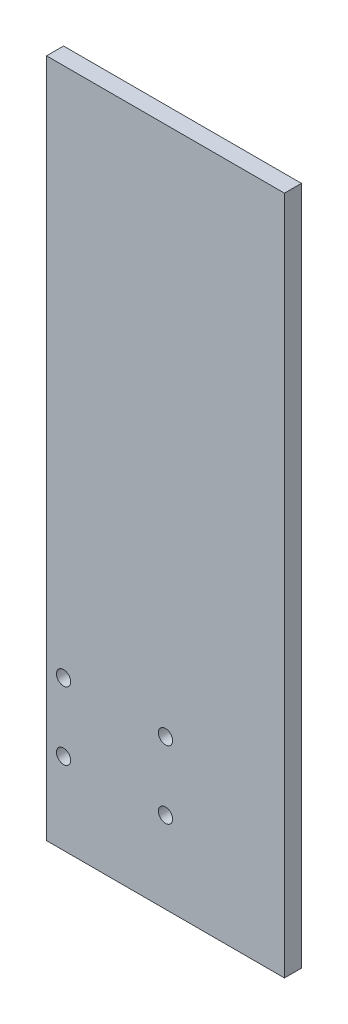
from build123d import *

# Parameters (mm, degrees)
SKETCH_1_W          = 100
SKETCH_1_H          = 200
EXTRUDE_1_DEPTH     = 5
CUT_EXTRUDE_2_DEPTH = 0.001
M4X0_7_HELICOIL_1_D = 4.2
SKETCH_13_W         = 10
SKETCH_13_H         = 200
CUT_EXTRUDE_4_DEPTH = 10
SKETCH_14_W         = 10
SKETCH_14_H         = 200
CUT_EXTRUDE_5_DEPTH = 10


with BuildPart() as part:
    # 스케치1 → 보스-돌출1 (new body)
    with BuildSketch(Plane.XY):
        Rectangle(SKETCH_1_W, SKETCH_1_H)
    extrude(amount=EXTRUDE_1_DEPTH)

    # 스케치3 → 컷-돌출2 (cut)
    # profile 1 of 5: a face of its own
    with BuildSketch(Plane(origin=(0, 0, 0), x_dir=(-1, 0, 0), z_dir=(0, 0, -1))):
        with BuildLine():
            Line((1.435897436, 3.568709936), (1.435897436, 3.241987179))
            add(Edge.make_bspline(
                [(1.435897436, 3.241987179), (1.406158657, 3.253938052), (1.349713836, 3.276621056), (1.26647346, 3.301285681), (1.189944626, 3.317221421), (1.140790736, 3.319457366), (1.117588141, 3.320512821)],
                knots=[0, 0, 0, 0, 1.16548392, 2.212112691, 3.15604595, 4, 4, 4, 4], degree=3))
            add(Edge.make_bspline(
                [(1.117588141, 3.320512821), (1.101914377, 3.31986148), (1.071575198, 3.318600703), (1.027971871, 3.312172427), (0.988682661, 3.299069626), (0.953777041, 3.28204035), (0.924826581, 3.260686166), (0.900040357, 3.239230902), (0.882073827, 3.215045722), (0.872318879, 3.192525311), (0.866368878, 3.171674318), (0.86457875, 3.150320052), (0.860193836, 3.124095966), (0.858971029, 3.091932248), (0.856183661, 3.054829537), (0.856430302, 3.012002641), (0.854146379, 2.964125498), (0.854488293, 2.930224949), (0.854667468, 2.912459936)],
                knots=[0, 0, 0, 0, 1.311993654, 2.539582093, 3.670788641, 4.763509788, 5.772417512, 6.671800701, 7.496729179, 8.266799162, 8.712543678, 9.304149002, 10.05334463, 10.934920737, 11.99209668, 13.165090968, 14.514413552, 16, 16, 16, 16], degree=3))
            Line((0.854667468, 2.912459936), (0.854667468, 2.557692308))
            Line((0.854667468, 2.557692308), (1.391025641, 2.557692308))
            Line((1.391025641, 2.557692308), (1.391025641, 2.243589744))
            Line((1.391025641, 2.243589744), (0.853966346, 2.243589744))
            Line((0.853966346, 2.243589744), (0.852564103, 0))
            Line((0.852564103, 0), (0.538461538, 0))
            Line((0.538461538, 0), (0.538461538, 2.243589744))
            Line((0.538461538, 2.243589744), (0.179487179, 2.243589744))
            Line((0.179487179, 2.243589744), (0.179487179, 2.557692308))
            Line((0.179487179, 2.557692308), (0.538461538, 2.557692308))
            Line((0.538461538, 2.557692308), (0.538461538, 2.966446314))
            add(Edge.make_bspline(
                [(0.538461538, 2.966446314), (0.538486753, 2.989121894), (0.538535124, 3.032622798), (0.541922975, 3.095232239), (0.544818696, 3.153055703), (0.550586323, 3.205644336), (0.557248029, 3.253490479), (0.566784189, 3.29588336), (0.57579556, 3.333965119), (0.592144152, 3.377067776), (0.616566371, 3.4259178), (0.656096568, 3.4775417), (0.703489575, 3.523846647), (0.760097899, 3.562854), (0.823813434, 3.595269478), (0.894694612, 3.618511331), (0.97196981, 3.631651776), (1.02545728, 3.633605985), (1.053084936, 3.634615385)],
                knots=[0, 0, 0, 0, 1.116398763, 2.141702935, 3.087165306, 3.966655413, 4.746276475, 5.464069668, 6.106083417, 6.67047701, 7.730773247, 8.782666744, 9.856985883, 10.980834087, 12.154321827, 13.366232824, 14.639591414, 16, 16, 16, 16], degree=3))
            add(Edge.make_bspline(
                [(1.053084936, 3.634615385), (1.081161694, 3.633658004), (1.140107358, 3.631648034), (1.232303961, 3.619214627), (1.331900478, 3.597743597), (1.400236399, 3.578665712), (1.435897436, 3.568709936)],
                knots=[0, 0, 0, 0, 0.864728408, 1.815451418, 2.859995356, 4, 4, 4, 4], degree=3))
        make_face()
    # profile 2 of 5: a face of its own
    with BuildSketch(Plane(origin=(0, 0, 0), x_dir=(-1, 0, 0), z_dir=(0, 0, -1))):
        with BuildLine():
            Line((1.794871795, 2.557692308), (2.108974359, 2.557692308))
            Line((2.108974359, 2.557692308), (2.108974359, 2.181189904))
            add(Edge.make_bspline(
                [(2.108974359, 2.181189904), (2.132163118, 2.216245732), (2.176511439, 2.283289731), (2.250224368, 2.371959032), (2.325727699, 2.445374079), (2.403382887, 2.503877598), (2.483760987, 2.547690717), (2.565097938, 2.579783752), (2.648673408, 2.598761067), (2.704835332, 2.601294726), (2.732972756, 2.602564103)],
                knots=[0, 0, 0, 0, 1.2804753, 2.448899062, 3.506932113, 4.484331642, 5.4025378, 6.288909075, 7.142734305, 8, 8, 8, 8], degree=3))
            add(Edge.make_bspline(
                [(2.732972756, 2.602564103), (2.754799083, 2.601373576), (2.799708168, 2.59892399), (2.867690758, 2.581713165), (2.93773421, 2.554235143), (2.982876597, 2.52839492), (3.006410256, 2.514923878)],
                knots=[0, 0, 0, 0, 0.901110191, 1.854092781, 2.881294221, 4, 4, 4, 4], degree=3))
            Line((3.006410256, 2.514923878), (2.833934295, 2.242888622))
            add(Edge.make_bspline(
                [(2.833934295, 2.242888622), (2.818825274, 2.249628888), (2.790145459, 2.262423203), (2.748190893, 2.277565213), (2.709509556, 2.286481129), (2.684865998, 2.287831847), (2.673377404, 2.288461538)],
                knots=[0, 0, 0, 0, 1.180555205, 2.24091978, 3.179933427, 4, 4, 4, 4], degree=3))
            add(Edge.make_bspline(
                [(2.673377404, 2.288461538), (2.64817167, 2.286781501), (2.59675928, 2.283354712), (2.521274781, 2.256415904), (2.448027575, 2.212890664), (2.389855913, 2.164619552), (2.34481366, 2.118071755), (2.312673435, 2.077423352), (2.283190688, 2.031844721), (2.255020467, 1.982115037), (2.229354173, 1.927385191), (2.205399504, 1.868201977), (2.183740641, 1.804496849), (2.171390397, 1.760114328), (2.165064103, 1.737379808)],
                knots=[0, 0, 0, 0, 1.125678352, 2.296057538, 3.5422874, 4.923748041, 5.663163013, 6.437101912, 7.23742474, 8.08941207, 8.991984279, 9.93940061, 10.944477711, 12, 12, 12, 12], degree=3))
            add(Edge.make_bspline(
                [(2.165064103, 1.737379808), (2.160331709, 1.717102634), (2.149849818, 1.672190235), (2.13965828, 1.596841711), (2.129588762, 1.507818052), (2.122492143, 1.404871459), (2.115914101, 1.288259015), (2.112204019, 1.15780307), (2.109100878, 1.013369718), (2.109017812, 0.912395365), (2.108974359, 0.859575321)],
                knots=[0, 0, 0, 0, 0.566838948, 1.255505196, 2.06880316, 3.007127437, 4.065329342, 5.249902469, 6.561414163, 8, 8, 8, 8], degree=3))
            Line((2.108974359, 0.859575321), (2.108974359, 0))
            Line((2.108974359, 0), (1.794871795, 0))
            Line((1.794871795, 0), (1.794871795, 2.557692308))
        make_face()
    # profile 3 of 5: a face of its own
    with BuildSketch(Plane(origin=(0, 0, 0), x_dir=(-1, 0, 0), z_dir=(0, 0, -1))):
        with BuildLine():
            add(Edge.make_bspline(
                [(4.555889423, 2.602564103), (4.603880696, 2.601542211), (4.697979853, 2.599538533), (4.835787739, 2.578123567), (4.967332875, 2.545376203), (5.093119067, 2.500104641), (5.211535363, 2.43942269), (5.324306607, 2.367013399), (5.431123616, 2.281230805), (5.495146645, 2.214872737), (5.527644231, 2.181189904)],
                knots=[0, 0, 0, 0, 1.054011418, 2.066658804, 3.057071809, 4.030435133, 4.997543892, 5.974964718, 6.972108034, 8, 8, 8, 8], degree=3))
            add(Edge.make_bspline(
                [(5.527644231, 2.181189904), (5.555626185, 2.148975918), (5.611048565, 2.085171376), (5.682114284, 1.981715763), (5.743335844, 1.874575662), (5.792398805, 1.762328336), (5.831083829, 1.645953664), (5.858549525, 1.525051653), (5.87488646, 1.399889306), (5.877089427, 1.314885468), (5.878205128, 1.271834936)],
                knots=[0, 0, 0, 0, 1.025258237, 2.030674902, 3.01204498, 3.988269485, 4.97094183, 5.956517959, 6.965070386, 8, 8, 8, 8], degree=3))
            add(Edge.make_bspline(
                [(5.878205128, 1.271834936), (5.877223791, 1.228534878), (5.875284623, 1.142971945), (5.856941006, 1.016952579), (5.82840992, 0.894757756), (5.787578082, 0.776899063), (5.735219973, 0.663016235), (5.671329285, 0.553606686), (5.595457668, 0.448454553), (5.509453671, 0.348452714), (5.414401795, 0.2562865), (5.311285647, 0.17595823), (5.202131613, 0.107136706), (5.08548826, 0.05170029), (4.962420773, 0.00799059), (4.832663705, -0.022709427), (4.696418635, -0.04127111), (4.603391413, -0.043654684), (4.555889423, -0.044871795)],
                knots=[0, 0, 0, 0, 0.998656419, 1.973391657, 2.932242238, 3.890759089, 4.846373663, 5.82037756, 6.809684879, 7.83454468, 8.860553229, 9.859544525, 10.845671541, 11.83227036, 12.833544569, 13.85385346, 14.904124723, 16, 16, 16, 16], degree=3))
            add(Edge.make_bspline(
                [(4.555889423, -0.044871795), (4.508154704, -0.043650599), (4.414663844, -0.041258824), (4.277937862, -0.022781541), (4.147948243, 0.007976441), (4.024719644, 0.051843934), (3.907574798, 0.107138478), (3.797788301, 0.175750167), (3.694588385, 0.256310322), (3.599516401, 0.348446259), (3.513517795, 0.448456216), (3.437644787, 0.553606254), (3.373754461, 0.663016348), (3.321396257, 0.776899033), (3.280564444, 0.894757764), (3.252033351, 1.016952577), (3.233689737, 1.142971945), (3.231750568, 1.228534878), (3.230769231, 1.271834936)],
                knots=[0, 0, 0, 0, 1.099876186, 2.154163076, 3.173186993, 4.173200201, 5.163417411, 6.152872554, 7.150605724, 8.17532212, 9.198891216, 10.186952605, 11.159729845, 12.11414092, 13.071450619, 14.029093627, 15.002601286, 16, 16, 16, 16], degree=3))
            add(Edge.make_bspline(
                [(3.230769231, 1.271834936), (3.231892541, 1.314651482), (3.234116503, 1.399420884), (3.250437012, 1.524347945), (3.277795568, 1.645045334), (3.316526965, 1.76097081), (3.366042155, 1.872726246), (3.426403443, 1.980131077), (3.498194076, 2.083118877), (3.553396027, 2.146840957), (3.581330128, 2.179086538)],
                knots=[0, 0, 0, 0, 1.031353054, 2.041901799, 3.029428768, 4.008703097, 4.981709435, 5.96992636, 6.972712378, 8, 8, 8, 8], degree=3))
            add(Edge.make_bspline(
                [(3.581330128, 2.179086538), (3.613778719, 2.213061478), (3.677594583, 2.279879174), (3.784943311, 2.365411698), (3.897437132, 2.439327772), (4.017162058, 2.498803987), (4.142844916, 2.545642505), (4.275064159, 2.57820802), (4.413339674, 2.599461375), (4.507899295, 2.601519553), (4.555889423, 2.602564103)],
                knots=[0, 0, 0, 0, 1.027980169, 2.021703884, 2.998553061, 3.971491411, 4.943284454, 5.930300938, 6.949603206, 8, 8, 8, 8], degree=3))
        make_face()
        with BuildLine():
            add(Edge.make_bspline(
                [(4.554487179, 2.288461538), (4.520549568, 2.287496947), (4.453550439, 2.285592664), (4.354930855, 2.27110876), (4.259990701, 2.248161255), (4.168549857, 2.215557199), (4.080916684, 2.1734583), (3.997007282, 2.12174994), (3.916574842, 2.061116984), (3.841192779, 1.991654312), (3.772010466, 1.915775317), (3.71153249, 1.834926959), (3.660107384, 1.750420612), (3.617267225, 1.662168401), (3.585360036, 1.569275987), (3.562187014, 1.472795356), (3.547716774, 1.37252994), (3.545830395, 1.304368921), (3.544871795, 1.269731571)],
                knots=[0, 0, 0, 0, 1.021534396, 2.016698045, 2.994645724, 3.958388632, 4.93408049, 5.916473867, 6.921342795, 7.962252576, 8.998418191, 10.008913653, 10.997312074, 11.973003931, 12.956656626, 13.948281152, 14.957379055, 16, 16, 16, 16], degree=3))
            add(Edge.make_bspline(
                [(3.544871795, 1.269731571), (3.546478619, 1.224979543), (3.549667863, 1.136155138), (3.575603099, 1.005344015), (3.618989379, 0.879762163), (3.677576659, 0.760145777), (3.750982878, 0.649473499), (3.837469944, 0.550802015), (3.936109645, 0.465616203), (4.045726145, 0.394935358), (4.164080463, 0.338775602), (4.289336784, 0.298976626), (4.419977478, 0.273104934), (4.509258209, 0.270533459), (4.554487179, 0.269230769)],
                knots=[0, 0, 0, 0, 1.016792936, 2.018143844, 3.017858371, 4.030088057, 5.03801393, 6.028138512, 7.003788237, 7.991172063, 8.984598303, 9.972568034, 10.972917682, 12, 12, 12, 12], degree=3))
            add(Edge.make_bspline(
                [(4.554487179, 0.269230769), (4.599713548, 0.270541049), (4.688989144, 0.273127506), (4.819448321, 0.298846326), (4.944362293, 0.338949987), (5.062593681, 0.394872197), (5.172160284, 0.465884611), (5.271509405, 0.550320988), (5.357258017, 0.64973484), (5.430591621, 0.760292369), (5.490138364, 0.879576721), (5.533321566, 1.005367193), (5.559319152, 1.136149235), (5.562499981, 1.224977566), (5.564102564, 1.269731571)],
                knots=[0, 0, 0, 0, 1.02726834, 2.027799167, 3.010890988, 4.004497153, 4.992059811, 5.971914811, 6.958719428, 7.966827853, 8.981595046, 9.981490638, 10.983022906, 12, 12, 12, 12], degree=3))
            add(Edge.make_bspline(
                [(5.564102564, 1.269731571), (5.563144294, 1.304369128), (5.561258565, 1.372530554), (5.546783601, 1.472793007), (5.523628061, 1.569284604), (5.491656444, 1.662136607), (5.44900243, 1.750649112), (5.396585637, 1.834678839), (5.336354611, 1.916055385), (5.26633749, 1.991409026), (5.191034113, 2.061144062), (5.110569074, 2.121773452), (5.026784096, 2.173231047), (4.939405513, 2.215917288), (4.847952945, 2.247864628), (4.753145816, 2.271241259), (4.654947006, 2.285531456), (4.588187963, 2.287478598), (4.554487179, 2.288461538)],
                knots=[0, 0, 0, 0, 1.042956736, 2.052379634, 3.044323526, 4.02829302, 5.004299113, 5.996692471, 7.007513377, 8.048758398, 9.090003419, 10.095195979, 11.07790575, 12.047570684, 13.018257071, 13.989683339, 14.985167495, 16, 16, 16, 16], degree=3))
        make_face(mode=Mode.SUBTRACT)
    # profile 4 of 5: a face of its own
    with BuildSketch(Plane(origin=(0, 0, 0), x_dir=(-1, 0, 0), z_dir=(0, 0, -1))):
        with BuildLine():
            Line((6.506410256, 2.557692308), (6.820512821, 2.557692308))
            Line((6.820512821, 2.557692308), (6.820512821, 2.096354167))
            add(Edge.make_bspline(
                [(6.820512821, 2.096354167), (6.854050456, 2.13819689), (6.919131407, 2.219394153), (7.02751574, 2.326114728), (7.14205964, 2.414059953), (7.262061644, 2.484163747), (7.387684654, 2.537010373), (7.518162924, 2.575176304), (7.65427763, 2.598061132), (7.746842067, 2.601051363), (7.793669872, 2.602564103)],
                knots=[0, 0, 0, 0, 1.12780773, 2.188550248, 3.19190651, 4.159438251, 5.104880172, 6.052711206, 7.014878035, 8, 8, 8, 8], degree=3))
            add(Edge.make_bspline(
                [(7.793669872, 2.602564103), (7.841000506, 2.600818907), (7.933637974, 2.597403139), (8.068516035, 2.570386448), (8.194489429, 2.524241192), (8.311108985, 2.461029122), (8.416236198, 2.382422649), (8.508561049, 2.290844867), (8.584924297, 2.185508784), (8.63612166, 2.087785627), (8.669847307, 2.001096833), (8.691079645, 1.926850083), (8.709110626, 1.844131932), (8.724742374, 1.753192343), (8.735319486, 1.653394153), (8.743661778, 1.545146461), (8.749640472, 1.42848433), (8.749877679, 1.347797703), (8.75, 1.306189904)],
                knots=[0, 0, 0, 0, 1.235846778, 2.418850247, 3.575807741, 4.728682307, 5.871620074, 6.994088408, 8.11269785, 9.256955736, 9.865816715, 10.540099792, 11.271859618, 12.076849838, 12.949306005, 13.892391288, 14.913166135, 16, 16, 16, 16], degree=3))
            Line((8.75, 1.306189904), (8.75, 0))
            Line((8.75, 0), (8.435897436, 0))
            Line((8.435897436, 0), (8.435897436, 1.203125))
            add(Edge.make_bspline(
                [(8.435897436, 1.203125), (8.435704228, 1.237947445), (8.435334654, 1.304556856), (8.434169007, 1.399925879), (8.431359201, 1.486412457), (8.427410888, 1.563809825), (8.421631857, 1.632043661), (8.415609226, 1.691252938), (8.408244249, 1.74136248), (8.401681336, 1.771527563), (8.398737981, 1.78505609)],
                knots=[0, 0, 0, 0, 1.430800155, 2.736877192, 3.918605307, 4.986035426, 5.920637409, 6.731861385, 7.431261377, 8, 8, 8, 8], degree=3))
            add(Edge.make_bspline(
                [(8.398737981, 1.78505609), (8.388112449, 1.824767275), (8.367661589, 1.901199019), (8.317127605, 2.004873372), (8.253313425, 2.09307156), (8.175415575, 2.165248281), (8.0841865, 2.221419118), (7.979879357, 2.260393073), (7.863500716, 2.284769342), (7.781646334, 2.287196474), (7.738982372, 2.288461538)],
                knots=[0, 0, 0, 0, 1.084156227, 2.086665306, 3.027808233, 3.945421172, 4.874247719, 5.839848303, 6.874090471, 8, 8, 8, 8], degree=3))
            add(Edge.make_bspline(
                [(7.738982372, 2.288461538), (7.713714688, 2.287985534), (7.663710595, 2.287043533), (7.589560623, 2.277592235), (7.51763645, 2.262133779), (7.447216241, 2.241265142), (7.379708447, 2.212602873), (7.312944156, 2.180073502), (7.249437392, 2.13952529), (7.187833995, 2.094334669), (7.130521187, 2.044255462), (7.077192849, 1.991410952), (7.029654829, 1.935135348), (6.986586153, 1.8763354), (6.94940789, 1.814203562), (6.916954802, 1.749339256), (6.889419107, 1.681657107), (6.875736415, 1.634682046), (6.868890224, 1.611177885)],
                knots=[0, 0, 0, 0, 1.023777757, 2.026029729, 3.023749952, 4.003683103, 4.997618607, 5.993177895, 7.010360494, 8.046726602, 9.087585522, 10.09234134, 11.086953743, 12.070360549, 13.043493632, 14.017870808, 15.008233677, 16, 16, 16, 16], degree=3))
            add(Edge.make_bspline(
                [(6.868890224, 1.611177885), (6.864950576, 1.593922682), (6.856374167, 1.556359007), (6.847110987, 1.494714588), (6.838703412, 1.423404613), (6.831666453, 1.342512296), (6.827361037, 1.251754421), (6.82266664, 1.151518583), (6.820957579, 1.041405094), (6.820665225, 0.964743402), (6.820512821, 0.924779647)],
                knots=[0, 0, 0, 0, 0.615963638, 1.340920617, 2.168419149, 3.115676021, 4.16674242, 5.331190069, 6.6087489, 8, 8, 8, 8], degree=3))
            Line((6.820512821, 0.924779647), (6.820512821, 0))
            Line((6.820512821, 0), (6.506410256, 0))
            Line((6.506410256, 0), (6.506410256, 2.557692308))
        make_face()
    # profile 5 of 5: a face of its own
    with BuildSketch(Plane(origin=(0, 0, 0), x_dir=(-1, 0, 0), z_dir=(0, 0, -1))):
        Polygon((9.782051282, 3.58974359), (10.096153846, 3.58974359), (10.096153846, 2.557692308), (10.544871795, 2.557692308), (10.544871795, 2.243589744), (10.096153846, 2.243589744), (10.096153846, 0), (9.782051282, 0), (9.782051282, 2.243589744), (9.333333333, 2.243589744), (9.333333333, 2.557692308), (9.782051282, 2.557692308), align=None)
    extrude(amount=-CUT_EXTRUDE_2_DEPTH, mode=Mode.SUBTRACT)

    # M4x0.7 Helicoil용 탭 구멍1 (through all)
    with Locations(Plane(origin=(0, 0, -5), x_dir=(-1, 0, 0), z_dir=(0, 0, -1))):
        with Locations((5, -76), (35, -76), (5, -56), (35, -56)):
            Hole(M4X0_7_HELICOIL_1_D / 2)

    # 스케치13 → 컷-돌출4 (cut)
    with BuildSketch(Plane.XY.offset(5)):
        with Locations((45, 0)):
            Rectangle(SKETCH_13_W, SKETCH_13_H)
        with Locations((-45, 0)):
            Rectangle(SKETCH_13_W, SKETCH_13_H)
    extrude(amount=-CUT_EXTRUDE_4_DEPTH, mode=Mode.SUBTRACT)

    # 스케치14 → 컷-돌출5 (cut)
    with BuildSketch(Plane.XY.offset(5)):
        with Locations((35, 0)):
            Rectangle(SKETCH_14_W, SKETCH_14_H)
    extrude(amount=-CUT_EXTRUDE_5_DEPTH, mode=Mode.SUBTRACT)


solid = part.part
